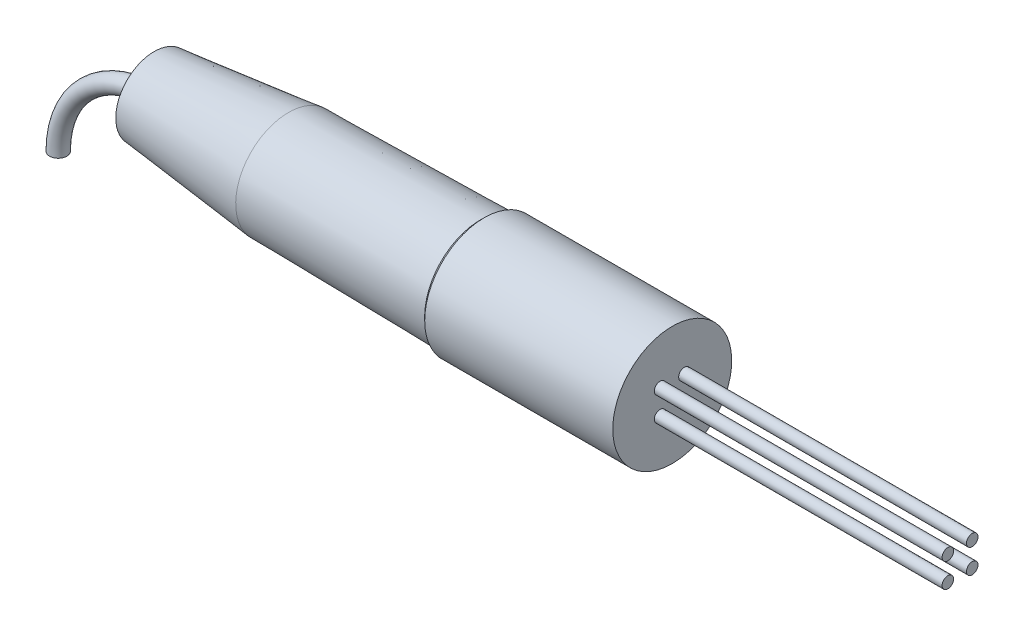
from build123d import *

# Parameters (mm, degrees)
CHAMFER_1_SIZE  = 0.2
SKETCH_4_R      = 0.45
SKETCH_5_R      = 0.3
EXTRUDE_2_DEPTH = 15


# Read off the part's stored shape, not the designer's step: 旋转2
with BuildPart() as part:
    # 旋转2 outline → 旋转2 (revolve)
    with BuildSketch(Plane.YX):
        Polygon((3.1, 0), (0, 0), (0, -27), (2, -27), (2.75, -20), (2.9, -10), (3.1, -10), align=None)
    revolve(axis=Axis((0, 0, 0), (1, 0, 0)))

    # 倒角1
    chamfer_1_edges = [part.edges().sort_by_distance(p)[0] for p in [
        (-10, -3.1, 0),
    ]]
    chamfer(chamfer_1_edges, length=CHAMFER_1_SIZE - 0.0001)  # a hair under: the kernel refuses the full size

    # 扫描1: sweep along a path in 草图3
    with BuildLine(Plane.XY) as sweep_1_path:
        ThreePointArc((-27, 0), (-30.535533906, -1.464466094), (-32, -5))
    # 草图4 → 扫描1 (sweep)
    with BuildSketch(Plane.ZY.offset(27)):
        Circle(SKETCH_4_R)
    sweep(path=sweep_1_path.line)

    # 草图5 → 拉伸2 (add)
    with BuildSketch(Plane(origin=(0, 0, 0), x_dir=(0, 0, -1), z_dir=(1, 0, 0))):
        with Locations(Location((-0.635, 0.635, 0), (0, 0, 270))):
            Circle(SKETCH_5_R)
        with Locations(Location((-0.635, -0.635, 0), (0, 0, 270))):
            Circle(SKETCH_5_R)
        with Locations(Location((0.635, 0.635, 0), (0, 0, 270))):
            Circle(SKETCH_5_R)
        with Locations(Location((0.635, -0.635, 0), (0, 0, 270))):
            Circle(SKETCH_5_R)
    extrude(amount=EXTRUDE_2_DEPTH)


solid = part.part
